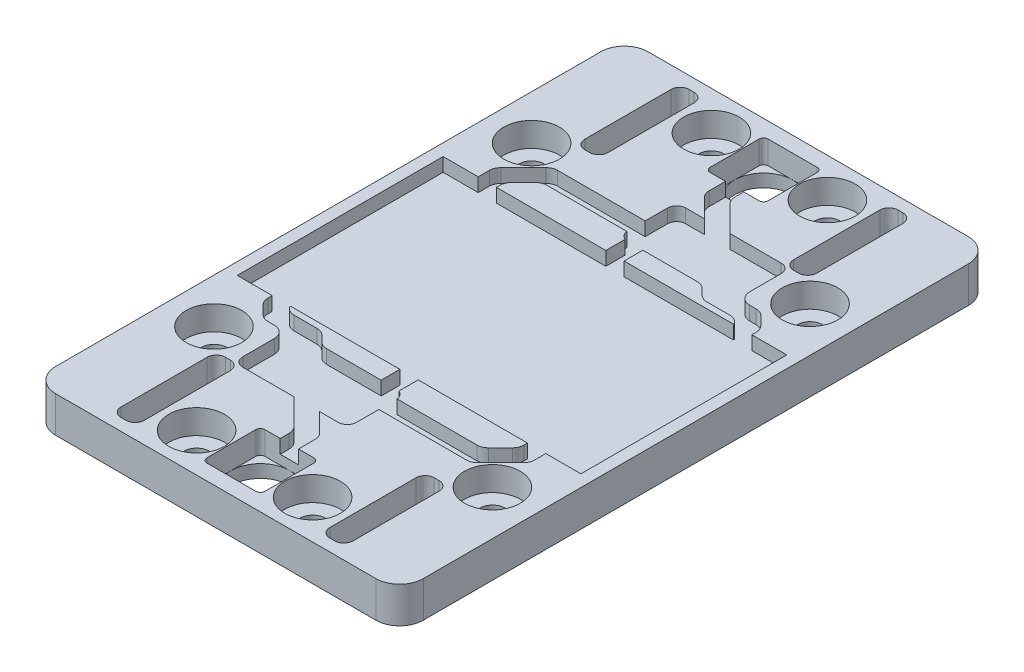
from build123d import *

# Parameters (mm, degrees)
SKETCH1_W                                  = 40.2336
SKETCH1_H                                  = 64.8462
BOSS_EXTRUDE1_DEPTH                        = 3.95
FILLET1_R                                  = 2.5908
SKETCH2_R                                  = 3.175
CUT_EXTRUDE1_DEPTH                         = 39.360729345
SKETCH3_W                                  = 6.35
SKETCH3_H                                  = 6.35
CUT_EXTRUDE2_DEPTH                         = 2.54
FILLET2_R                                  = 0.5
SKETCH5_R                                  = 1.375
CUT_EXTRUDE4_DEPTH                         = 39.360729345
SKETCH6_R                                  = 3.045
CUT_EXTRUDE5_DEPTH                         = 2.66
MIRROR2_AT_THE_SECOND_PLANE_COPY_1_SKETC_R = 1.375
MIRROR2_AT_THE_SECOND_PLANE_COPY_1_DEPTH   = 39.360729345
MIRROR2_AT_THE_SECOND_PLANE_COPY_2_SKETC_R = 3.045
MIRROR2_AT_THE_SECOND_PLANE_COPY_2_DEPTH   = 2.66
SKETCH7_W                                  = 2.54
SKETCH7_H                                  = 11.43
CUT_EXTRUDE6_DEPTH                         = 39.360729345
FILLET3_R                                  = 1
FILLET3_OF_MIRROR5_R                       = 1
MIRROR6_DEPTH                              = 3.95
SKETCH8_W                                  = 12.446
SKETCH8_H                                  = 6.35
CUT_EXTRUDE7_DEPTH                         = 1.5
FILLET4_R                                  = 1
SKETCH9_W                                  = 2
SKETCH9_H                                  = 4.545734335
CUT_EXTRUDE8_DEPTH                         = 1.5
SKETCH10_W                                 = 37.619999944
SKETCH10_H                                 = 22.54
CUT_EXTRUDE9_DEPTH                         = 1.5
SKETCH11_W                                 = 2
SKETCH11_H                                 = 7.845333995
CUT_EXTRUDE10_DEPTH                        = 1.5
CUT_EXTRUDE11_DEPTH                        = 1.5
CUT_EXTRUDE12_DEPTH                        = 1.5
FILLET5_R                                  = 1.27
SKETCH14_W                                 = 0.536836972
SKETCH14_H                                 = 2
CUT_EXTRUDE13_DEPTH                        = 1.5
FILLET2_OF_MIRROR7_R                       = 0.5
CIRPATTERN1_START                          = 2.45
CIRPATTERN1_DEPTH                          = 1.5


# Read off the part's stored shape, not the designer's step: Mirror6, CirPattern1
with BuildPart() as part:
    # Sketch1 → Boss-Extrude1 (new body)
    with BuildSketch(Plane(origin=(0, 0, 0), x_dir=(1, 0, 0), z_dir=(0, 1, 0))):
        Rectangle(SKETCH1_W, SKETCH1_H)
    extrude(amount=BOSS_EXTRUDE1_DEPTH)

    # Fillet1
    fillet1_edges = [part.edges().sort_by_distance(p)[0] for p in [
        (20.1168, 1.975, 32.4231),
        (-20.1168, 1.975, 32.4231),
        (-20.1168, 1.975, -32.4231),
        (20.1168, 1.975, -32.4231),
    ]]
    fillet(fillet1_edges, radius=FILLET1_R)

    # Sketch2 → Cut-Extrude1 (cut, through all)
    with BuildSketch(Plane(origin=(0, 3.95, 0), x_dir=(1, 0, 0), z_dir=(0, 1, 0))):
        with Locations(Location((0, 27.5463, 0), (0, 0, 270))):
            Circle(SKETCH2_R)
    cut_extrude1 = extrude(amount=-CUT_EXTRUDE1_DEPTH, mode=Mode.SUBTRACT)

    # Sketch3 → Cut-Extrude2 (cut)
    with BuildSketch(Plane(origin=(0, 3.95, 0), x_dir=(1, 0, 0), z_dir=(0, 1, 0))):
        with Locations((0, 27.5463)):
            Rectangle(SKETCH3_W, SKETCH3_H)
    cut_extrude2 = extrude(amount=-CUT_EXTRUDE2_DEPTH, mode=Mode.SUBTRACT)

    # Fillet2
    fillet2_edges = [part.edges().sort_by_distance(p)[0] for p in [
        (3.175, 2.68, -30.7213),
        (3.175, 2.68, -24.3713),
        (-3.175, 2.68, -24.3713),
        (-3.175, 2.68, -30.7213),
    ]]
    fillet(fillet2_edges, radius=FILLET2_R)

    # Sketch5 → Cut-Extrude4 (cut, through all)
    with BuildSketch(Plane(origin=(0, 3.95, 0), x_dir=(1, 0, 0), z_dir=(0, 1, 0))):
        with Locations(Location((-6.35, 28.1813, 0), (0, 0, 270))):
            Circle(SKETCH5_R)
        with Locations(Location((-15.24, 17.3863, 0), (0, 0, 270))):
            Circle(SKETCH5_R)
    cut_extrude4 = extrude(amount=-CUT_EXTRUDE4_DEPTH, mode=Mode.SUBTRACT)

    # Sketch6 → Cut-Extrude5 (cut)
    with BuildSketch(Plane(origin=(0, 3.95, 0), x_dir=(1, 0, 0), z_dir=(0, 1, 0))):
        with Locations(Location((-6.35, 28.1813, 0), (0, 0, 270))):
            Circle(SKETCH6_R)
        with Locations(Location((-15.24, 17.3863, 0), (0, 0, 270))):
            Circle(SKETCH6_R)
    cut_extrude5 = extrude(amount=-CUT_EXTRUDE5_DEPTH, mode=Mode.SUBTRACT)

    # Mirror2: Cut-Extrude4, Cut-Extrude5 across plane
    add(cut_extrude4.mirror(Plane(origin=(0, 0, 0), x_dir=(0, 0, 1), z_dir=(1, 0, 0))), mode=Mode.SUBTRACT)
    add(cut_extrude5.mirror(Plane(origin=(0, 0, 0), x_dir=(0, 0, 1), z_dir=(1, 0, 0))), mode=Mode.SUBTRACT)

    # Mirror2 at the second plane: Cut-Extrude4, Cut-Extrude5 across plane
    add(cut_extrude4.mirror(Plane.XY), mode=Mode.SUBTRACT)
    add(cut_extrude5.mirror(Plane.XY), mode=Mode.SUBTRACT)

    # Mirror2 at the second plane copy 1 sketc → Mirror2 at the second plane copy 1 (cut, through all)
    with BuildSketch(Plane(origin=(0, 3.95, 0), x_dir=(-1, 0, 0), z_dir=(0, 1, 0))):
        with Locations(Location((-6.35, 28.1813, 0), (0, 0, 270))):
            Circle(MIRROR2_AT_THE_SECOND_PLANE_COPY_1_SKETC_R)
        with Locations(Location((-15.24, 17.3863, 0), (0, 0, 270))):
            Circle(MIRROR2_AT_THE_SECOND_PLANE_COPY_1_SKETC_R)
    extrude(amount=-MIRROR2_AT_THE_SECOND_PLANE_COPY_1_DEPTH, mode=Mode.SUBTRACT)

    # Mirror2 at the second plane copy 2 sketc → Mirror2 at the second plane copy 2 (cut)
    with BuildSketch(Plane(origin=(0, 3.95, 0), x_dir=(-1, 0, 0), z_dir=(0, 1, 0))):
        with Locations(Location((-6.35, 28.1813, 0), (0, 0, 270))):
            Circle(MIRROR2_AT_THE_SECOND_PLANE_COPY_2_SKETC_R)
        with Locations(Location((-15.24, 17.3863, 0), (0, 0, 270))):
            Circle(MIRROR2_AT_THE_SECOND_PLANE_COPY_2_SKETC_R)
    extrude(amount=-MIRROR2_AT_THE_SECOND_PLANE_COPY_2_DEPTH, mode=Mode.SUBTRACT)

    # Sketch7 → Cut-Extrude6 (cut, through all)
    with BuildSketch(Plane(origin=(0, 3.95, 0), x_dir=(1, 0, 0), z_dir=(0, 1, 0))):
        with Locations((-11.43, 25.3873)):
            Rectangle(SKETCH7_W, SKETCH7_H)
    cut_extrude6 = extrude(amount=-CUT_EXTRUDE6_DEPTH, mode=Mode.SUBTRACT)

    # Fillet3
    fillet3_edges = [part.edges().sort_by_distance(p)[0] for p in [
        (-10.16, 1.975, -31.1023),
        (-10.16, 1.975, -19.6723),
        (-12.7, 1.975, -19.6723),
        (-12.7, 1.975, -31.1023),
    ]]
    fillet(fillet3_edges, radius=FILLET3_R)

    # Mirror5: Cut-Extrude6 across plane
    add(cut_extrude6.mirror(Plane(origin=(0, 0, 0), x_dir=(0, 0, 1), z_dir=(1, 0, 0))), mode=Mode.SUBTRACT)

    # Fillet3 of Mirror5
    fillet3_of_mirror5_edges = [part.edges().sort_by_distance(p)[0] for p in [
        (10.16, 1.975, -31.1023),
        (10.16, 1.975, -19.6723),
        (12.7, 1.975, -19.6723),
        (12.7, 1.975, -31.1023),
    ]]
    fillet(fillet3_of_mirror5_edges, radius=FILLET3_OF_MIRROR5_R)

    # Mirror6 outline → Mirror6 (cut)
    with BuildSketch(Plane(origin=(0, 0, 0), x_dir=(1, 0, 0), z_dir=(0, 1, 0))):
        with BuildLine():
            Line((-10.16, -30.1023), (-10.16, -20.6723))
            ThreePointArc((-10.16, -20.6723), (-10.452893219, -19.965193219), (-11.16, -19.6723))
            Line((-11.16, -19.6723), (-11.7, -19.6723))
            ThreePointArc((-11.7, -19.6723), (-12.407106781, -19.965193219), (-12.7, -20.6723))
            Line((-12.7, -20.6723), (-12.7, -30.1023))
            ThreePointArc((-12.7, -30.1023), (-12.407106781, -30.809406781), (-11.7, -31.1023))
            Line((-11.7, -31.1023), (-11.16, -31.1023))
            ThreePointArc((-11.16, -31.1023), (-10.452893219, -30.809406781), (-10.16, -30.1023))
        make_face()
        with BuildLine():
            ThreePointArc((11.16, -19.6723), (10.452893219, -19.965193219), (10.16, -20.6723))
            Line((10.16, -20.6723), (10.16, -30.1023))
            ThreePointArc((10.16, -30.1023), (10.452893219, -30.809406781), (11.16, -31.1023))
            Line((11.16, -31.1023), (11.7, -31.1023))
            ThreePointArc((11.7, -31.1023), (12.407106781, -30.809406781), (12.7, -30.1023))
            Line((12.7, -30.1023), (12.7, -20.6723))
            ThreePointArc((12.7, -20.6723), (12.407106781, -19.965193219), (11.7, -19.6723))
            Line((11.7, -19.6723), (11.16, -19.6723))
        make_face()
    extrude(amount=MIRROR6_DEPTH, mode=Mode.SUBTRACT)

    # Sketch8 → Cut-Extrude7 (cut)
    with BuildSketch(Plane(origin=(0, 3.95, 0), x_dir=(1, 0, 0), z_dir=(0, 1, 0))):
        with Locations((4.572, 16.4973)):
            Rectangle(SKETCH8_W, SKETCH8_H)
    extrude(amount=-CUT_EXTRUDE7_DEPTH, mode=Mode.SUBTRACT)

    # Fillet4
    fillet4_edges = [part.edges().sort_by_distance(p)[0] for p in [
        (-1.651, 3.2, -13.3223),
        (-1.651, 3.2, -19.6723),
        (10.795, 3.2, -19.6723),
        (10.795, 3.2, -13.3223),
    ]]
    fillet(fillet4_edges, radius=FILLET4_R)

    # Sketch9 → Cut-Extrude8 (cut)
    with BuildSketch(Plane(origin=(0, 3.95, 0), x_dir=(1, 0, 0), z_dir=(0, 1, 0))):
        Polygon((1, 22.8473), (-1, 22.8473), (-1, 22.049292091), (1.376992091, 19.6723), (4.205419215, 19.6723), (1, 22.877719215), align=None)
        with Locations((0, 25.120167168)):
            Rectangle(SKETCH9_W, SKETCH9_H)
    extrude(amount=-CUT_EXTRUDE8_DEPTH, mode=Mode.SUBTRACT)

    # Sketch10 → Cut-Extrude9 (cut)
    with BuildSketch(Plane(origin=(0, 3.95, 0), x_dir=(1, 0, 0), z_dir=(0, 1, 0))):
        Rectangle(SKETCH10_W, SKETCH10_H)
    extrude(amount=-CUT_EXTRUDE9_DEPTH, mode=Mode.SUBTRACT)

    # Sketch11 → Cut-Extrude10 (cut)
    with BuildSketch(Plane(origin=(0, 3.95, 0), x_dir=(1, 0, 0), z_dir=(0, 1, 0))):
        with Locations((0, 15.192666998)):
            Rectangle(SKETCH11_W, SKETCH11_H)
    extrude(amount=-CUT_EXTRUDE10_DEPTH, mode=Mode.SUBTRACT)

    # Sketch12 → Cut-Extrude11 (cut)
    with BuildSketch(Plane(origin=(0, 3.95, 0), x_dir=(1, 0, 0), z_dir=(0, 1, 0))):
        Polygon((-1.651, 16.2273), (-11.749301111, 16.2273), (-14.97, 13.006601111), (-14.97, 11.27), (-12.97, 11.27), (-12.97, 12.178173986), (-10.920873986, 14.2273), (-1.651, 14.2273), align=None)
    extrude(amount=-CUT_EXTRUDE11_DEPTH, mode=Mode.SUBTRACT)

    # Sketch13 → Cut-Extrude12 (cut)
    with BuildSketch(Plane(origin=(0, 3.95, 0), x_dir=(1, 0, 0), z_dir=(0, 1, 0))):
        Polygon((7.49397349, 13.3223), (8.89097349, 11.9253), (12.446, 11.9253), (12.954, 11.4173), (12.954, 11.27), (14.986, 11.27), (14.986, 12.258981959), (13.287681959, 13.9573), (10.795, 13.9573), (7.49397349, 13.9573), align=None)
    extrude(amount=-CUT_EXTRUDE12_DEPTH, mode=Mode.SUBTRACT)

    # Fillet5
    fillet5_edges = [part.edges().sort_by_distance(p)[0] for p in [
        (-12.97, 3.2, -12.178173986),
        (-10.920873986, 3.2, -14.2273),
        (-14.97, 3.2, -13.006601111),
        (-11.749301111, 3.2, -16.2273),
        (1, 3.2, -22.877719215),
        (-1, 3.2, -22.049292091),
        (7.49397349, 3.2, -13.3223),
        (8.89097349, 3.2, -11.9253),
        (12.446, 3.2, -11.9253),
        (10.726007519, 3.2, -13.9573),
        (13.287681959, 3.2, -13.9573),
        (14.986, 3.2, -12.258981959),
    ]]
    fillet(fillet5_edges, radius=FILLET5_R)

    # Sketch14 → Cut-Extrude13 (cut)
    with BuildSketch(Plane(origin=(0, 3.95, 0), x_dir=(1, 0, 0), z_dir=(0, 1, 0))):
        with Locations((-1.382581514, 15.2273)):
            Rectangle(SKETCH14_W, SKETCH14_H)
    extrude(amount=-CUT_EXTRUDE13_DEPTH, mode=Mode.SUBTRACT)

    # Mirror7: Cut-Extrude1, Cut-Extrude2 across plane
    add(cut_extrude1.mirror(Plane.XY), mode=Mode.SUBTRACT)
    add(cut_extrude2.mirror(Plane.XY), mode=Mode.SUBTRACT)

    # Fillet2 of Mirror7
    fillet2_of_mirror7_edges = [part.edges().sort_by_distance(p)[0] for p in [
        (3.175, 2.68, 30.7213),
        (3.175, 2.68, 24.3713),
        (-3.175, 2.68, 24.3713),
        (-3.175, 2.68, 30.7213),
    ]]
    fillet(fillet2_of_mirror7_edges, radius=FILLET2_OF_MIRROR7_R)

    # CirPattern1 outline → CirPattern1 (cut)
    with BuildSketch(Plane(origin=(0, 0, 0), x_dir=(1, 0, 0), z_dir=(0, 1, 0)).offset(CIRPATTERN1_START)):
        with BuildLine():
            ThreePointArc((-10.795, -18.6723), (-10.502106781, -19.379406781), (-9.795, -19.6723))
            Line((-9.795, -19.6723), (-4.205419215, -19.6723))
            Line((-4.205419215, -19.6723), (-1.371974388, -22.505744827))
            ThreePointArc((-1.371974388, -22.505744827), (-1.096672994, -22.91776248), (-1, -23.40377044))
            Line((-1, -23.40377044), (-1, -24.3713))
            Line((-1, -24.3713), (1, -24.3713))
            Line((1, -24.3713), (1, -22.575343315))
            ThreePointArc((1, -22.575343315), (0.903327006, -22.089335356), (0.628025612, -21.677317703))
            Line((0.628025612, -21.677317703), (-1.376992091, -19.6723))
            Line((-1.376992091, -19.6723), (0.651, -19.6723))
            ThreePointArc((0.651, -19.6723), (1.358106781, -19.379406781), (1.651, -18.6723))
            Line((1.651, -18.6723), (1.651, -16.2273))
            Line((1.651, -16.2273), (11.223249886, -16.2273))
            ThreePointArc((11.223249886, -16.2273), (11.709257846, -16.130627006), (12.121275499, -15.855325612))
            Line((12.121275499, -15.855325612), (14.598025612, -13.378575499))
            ThreePointArc((14.598025612, -13.378575499), (14.873327006, -12.966557846), (14.97, -12.480549886))
            Line((14.97, -12.480549886), (14.97, -11.27))
            Line((14.97, -11.27), (12.97, -11.27))
            Line((12.97, -11.27), (12.97, -11.652122762))
            ThreePointArc((12.97, -11.652122762), (12.873327006, -12.138130721), (12.598025612, -12.550148374))
            Line((12.598025612, -12.550148374), (11.292848374, -13.855325612))
            ThreePointArc((11.292848374, -13.855325612), (10.880830721, -14.130627006), (10.394822762, -14.2273))
            Line((10.394822762, -14.2273), (1.646477272, -14.2273))
            ThreePointArc((1.646477272, -14.2273), (1.444219676, -13.713364416), (1, -13.385177276))
            Line((1, -13.385177276), (1, -11.27))
            Line((1, -11.27), (-1, -11.27))
            Line((-1, -11.27), (-1, -13.3223))
            Line((-1, -13.3223), (-6.967922266, -13.3223))
            ThreePointArc((-6.967922266, -13.3223), (-7.453930225, -13.225627006), (-7.865947878, -12.950325612))
            Line((-7.865947878, -12.950325612), (-8.518999102, -12.297274388))
            ThreePointArc((-8.518999102, -12.297274388), (-8.931016755, -12.021972994), (-9.417024714, -11.9253))
            Line((-9.417024714, -11.9253), (-11.919948776, -11.9253))
            ThreePointArc((-11.919948776, -11.9253), (-12.405956735, -11.828627006), (-12.817974388, -11.553325612))
            Line((-12.817974388, -11.553325612), (-12.954, -11.4173))
            Line((-12.954, -11.4173), (-12.954, -11.27))
            Line((-12.954, -11.27), (-14.986, -11.27))
            Line((-14.986, -11.27), (-14.986, -11.732930735))
            ThreePointArc((-14.986, -11.732930735), (-14.889327006, -12.218938694), (-14.614025612, -12.630956347))
            Line((-14.614025612, -12.630956347), (-13.659656347, -13.585325612))
            ThreePointArc((-13.659656347, -13.585325612), (-13.247638694, -13.860627006), (-12.761630735, -13.9573))
            Line((-12.761630735, -13.9573), (-12.065, -13.9573))
            ThreePointArc((-12.065, -13.9573), (-11.166974388, -14.329274388), (-10.795, -15.2273))
            Line((-10.795, -15.2273), (-10.795, -18.6723))
        make_face()
    extrude(amount=CIRPATTERN1_DEPTH, mode=Mode.SUBTRACT)


solid = part.part
